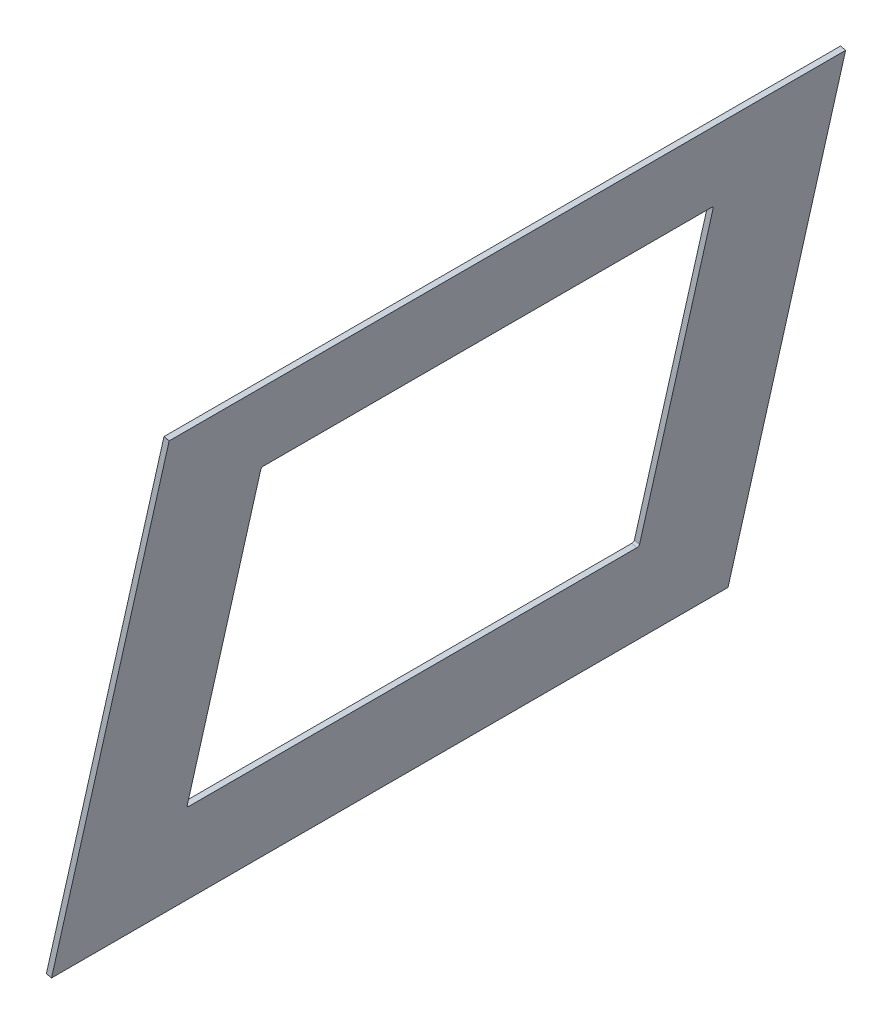
from build123d import *

# Parameters (mm, degrees)
BOSS_EXTRUDE1_DEPTH = 812.8
CUT_EXTRUDE1_DEPTH  = 6.35


with BuildPart() as part:
    # Sketch2 → Boss-Extrude1 (new body)
    with BuildSketch(Plane.XY):
        Polygon((-603.061326374, 1609.624938249), (-744.388283621, 980.077583241), (-738.19248542, 978.686689767), (-596.865528173, 1608.234044775), align=None)
    extrude(amount=BOSS_EXTRUDE1_DEPTH)

    # Sketch3 → Cut-Extrude1 (cut)
    with BuildSketch(Plane(origin=(-918.135640896, 206.11208265, 0), x_dir=(0, 0, 1), z_dir=(-0.9757162520935705, 0.21903834230672012, 0))):
        with BuildLine():
            Line((134.6454, 922.768050604), (134.6454, 1326.342300604))
            ThreePointArc((134.6454, 1326.342300604), (135.389348776, 1328.138351828), (137.1854, 1328.882300604))
            Line((137.1854, 1328.882300604), (675.6146, 1328.882300604))
            ThreePointArc((675.6146, 1328.882300604), (677.410651224, 1328.138351828), (678.1546, 1326.342300604))
            Line((678.1546, 1326.342300604), (678.1546, 922.768050604))
            ThreePointArc((678.1546, 922.768050604), (677.410651224, 920.97199938), (675.6146, 920.228050604))
            Line((675.6146, 920.228050604), (137.1854, 920.228050604))
            ThreePointArc((137.1854, 920.228050604), (135.389348776, 920.97199938), (134.6454, 922.768050604))
        make_face()
    extrude(amount=-CUT_EXTRUDE1_DEPTH, mode=Mode.SUBTRACT)


solid = part.part
